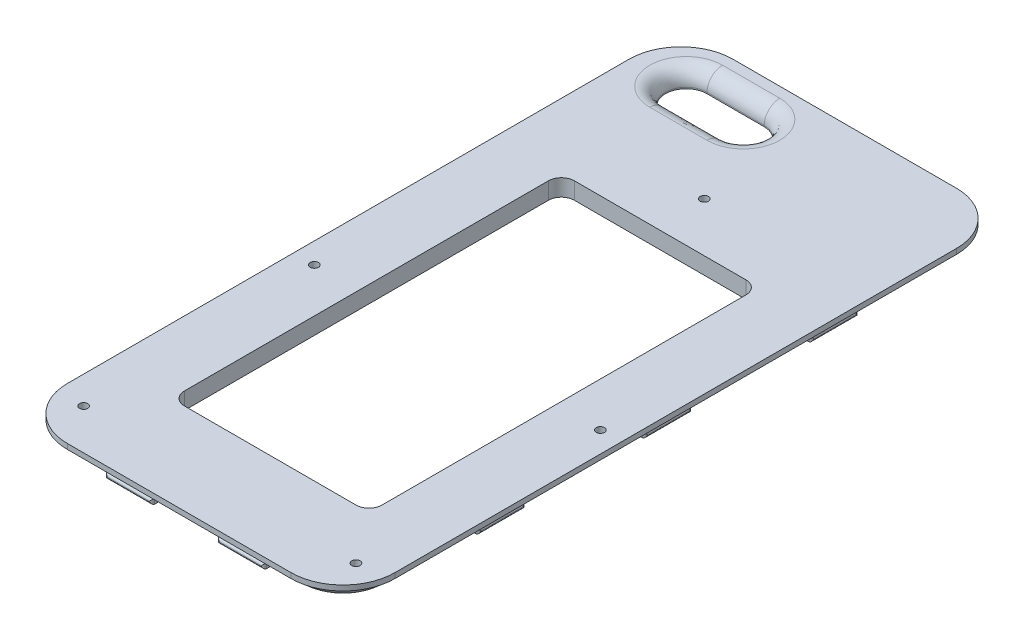
from build123d import *

# Parameters (mm, degrees)
BOSS_EXTRUDE1_DEPTH = 1
BOSS_EXTRUDE2_DEPTH = 2.25
SKETCH4_W           = 9
SKETCH4_H           = 1
BOSS_EXTRUDE3_DEPTH = 1
FILLET1_R           = 0.5
SKETCH5_W           = 9
SKETCH5_H           = 1
BOSS_EXTRUDE4_DEPTH = 1
FILLET2_R           = 0.5
SKETCH6_W           = 9
SKETCH6_H           = 1
BOSS_EXTRUDE5_DEPTH = 0.6
FILLET3_R           = 0.5
SKETCH7_W           = 9
SKETCH7_H           = 1
BOSS_EXTRUDE6_DEPTH = 0.6
FILLET4_R           = 0.5
CUT_EXTRUDE1_DEPTH  = 4
CUT_EXTRUDE2_DEPTH  = 4
FILLET6_R           = 1
FILLET7_SIZE        = 3
SKETCH12_R          = 0.8
CUT_EXTRUDE5_DEPTH  = 12
CHAMFER3_SIZE       = 1.5
CHAMFER3_SIZE_2     = 0.866025404
CHAMFER4_SIZE       = 1.5
CHAMFER4_SIZE_2     = 0.866025404


# Some blends are built 0.0001 mm under size
with BuildPart() as part:
    # Sketch2 → Boss-Extrude1 (new body)
    with BuildSketch(Plane(origin=(0, 0, 0), x_dir=(1, 0, 0), z_dir=(0, 1, 0))):
        with BuildLine():
            Line((-51.171175855, 92.369672547), (-51.171175855, -15.630327453))
            ThreePointArc((-51.171175855, -15.630327453), (-48.242243667, -22.701395265), (-41.171175855, -25.630327453))
            Line((-41.171175855, -25.630327453), (1.828824145, -25.630327453))
            ThreePointArc((1.828824145, -25.630327453), (8.899891957, -22.701395265), (11.828824145, -15.630327453))
            Line((11.828824145, -15.630327453), (11.828824145, 92.369672547))
            ThreePointArc((11.828824145, 92.369672547), (8.899891957, 99.440740359), (1.828824145, 102.369672547))
            Line((1.828824145, 102.369672547), (-41.171175855, 102.369672547))
            ThreePointArc((-41.171175855, 102.369672547), (-48.242243667, 99.440740359), (-51.171175855, 92.369672547))
        make_face()
    extrude(amount=BOSS_EXTRUDE1_DEPTH)

    # Sketch3 → Boss-Extrude2 (add)
    with BuildSketch(Plane.XZ):
        with BuildLine():
            Line((-41.171175855, -100.369672547), (1.828824145, -100.369672547))
            ThreePointArc((1.828824145, -100.369672547), (7.485678395, -98.026526797), (9.828824145, -92.369672547))
            Line((9.828824145, -92.369672547), (9.828824145, 15.630327453))
            ThreePointArc((9.828824145, 15.630327453), (7.485678395, 21.287181702), (1.828824145, 23.630327453))
            Line((1.828824145, 23.630327453), (-41.171175855, 23.630327453))
            ThreePointArc((-41.171175855, 23.630327453), (-46.828030104, 21.287181702), (-49.171175855, 15.630327453))
            Line((-49.171175855, 15.630327453), (-49.171175855, -92.369672547))
            ThreePointArc((-49.171175855, -92.369672547), (-46.828030104, -98.026526797), (-41.171175855, -100.369672547))
        make_face()
    extrude(amount=BOSS_EXTRUDE2_DEPTH)

    # Sketch4 → Boss-Extrude3 (add)
    with BuildSketch(Plane(origin=(0, 0, -100.369672547), x_dir=(-1, 0, 0), z_dir=(0, 0, -1))):
        with Locations((30.421175855, -1.75)):
            Rectangle(SKETCH4_W, SKETCH4_H)
        with Locations((8.921175855, -1.75)):
            Rectangle(SKETCH4_W, SKETCH4_H)
    extrude(amount=BOSS_EXTRUDE3_DEPTH)

    # Fillet1
    fillet1_edges = [part.edges().sort_by_distance(p)[0] for p in [
        (-25.921175855, -1.75, -101.369672547),
        (-30.421175855, -2.25, -101.369672547),
        (-34.921175855, -1.75, -101.369672547),
        (-30.421175855, -1.25, -101.369672547),
        (-4.421175855, -1.75, -101.369672547),
        (-8.921175855, -2.25, -101.369672547),
        (-13.421175855, -1.75, -101.369672547),
        (-8.921175855, -1.25, -101.369672547),
    ]]
    fillet(fillet1_edges, radius=FILLET1_R - 0.0001)  # a hair under: the kernel refuses the full size

    # Sketch5 → Boss-Extrude4 (add)
    with BuildSketch(Plane.XY.offset(23.630327453)):
        with Locations((-8.921175855, -1.75)):
            Rectangle(SKETCH5_W, SKETCH5_H)
        with Locations((-30.421175855, -1.75)):
            Rectangle(SKETCH5_W, SKETCH5_H)
    extrude(amount=BOSS_EXTRUDE4_DEPTH)

    # Fillet2
    fillet2_edges = [part.edges().sort_by_distance(p)[0] for p in [
        (-34.921175855, -1.75, 24.630327453),
        (-30.421175855, -2.25, 24.630327453),
        (-25.921175855, -1.75, 24.630327453),
        (-30.421175855, -1.25, 24.630327453),
        (-13.421175855, -1.75, 24.630327453),
        (-8.921175855, -2.25, 24.630327453),
        (-4.421175855, -1.75, 24.630327453),
        (-8.921175855, -1.25, 24.630327453),
    ]]
    fillet(fillet2_edges, radius=FILLET2_R - 0.0001)  # a hair under: the kernel refuses the full size

    # Sketch6 → Boss-Extrude5 (add)
    with BuildSketch(Plane.ZY.offset(49.171175855)):
        with Locations((-6.369672547, -1.75)):
            Rectangle(SKETCH6_W, SKETCH6_H)
        with Locations((-38.369672547, -1.75)):
            Rectangle(SKETCH6_W, SKETCH6_H)
        with Locations((-70.869672547, -1.75)):
            Rectangle(SKETCH6_W, SKETCH6_H)
    extrude(amount=BOSS_EXTRUDE5_DEPTH)

    # Fillet3
    fillet3_edges = [part.edges().sort_by_distance(p)[0] for p in [
        (-49.771175855, -2.25, -6.369672547),
        (-49.771175855, -1.75, -1.869672547),
        (-49.771175855, -1.25, -6.369672547),
        (-49.771175855, -1.75, -10.869672547),
        (-49.771175855, -2.25, -70.869672547),
        (-49.771175855, -1.75, -66.369672547),
        (-49.771175855, -1.25, -70.869672547),
        (-49.771175855, -1.75, -75.369672547),
        (-49.771175855, -1.75, -42.869672547),
        (-49.771175855, -2.25, -38.369672547),
        (-49.771175855, -1.75, -33.869672547),
        (-49.771175855, -1.25, -38.369672547),
    ]]
    fillet(fillet3_edges, radius=FILLET3_R - 0.0001)  # a hair under: the kernel refuses the full size

    # Sketch7 → Boss-Extrude6 (add)
    with BuildSketch(Plane(origin=(9.828824145, 0, 0), x_dir=(0, 0, -1), z_dir=(1, 0, 0))):
        with Locations((70.369672547, -1.75)):
            Rectangle(SKETCH7_W, SKETCH7_H)
        with Locations((38.369672547, -1.75)):
            Rectangle(SKETCH7_W, SKETCH7_H)
        with Locations((6.369672547, -1.75)):
            Rectangle(SKETCH7_W, SKETCH7_H)
    extrude(amount=BOSS_EXTRUDE6_DEPTH)

    # Fillet4
    fillet4_edges = [part.edges().sort_by_distance(p)[0] for p in [
        (10.428824145, -2.25, -70.369672547),
        (10.428824145, -1.75, -74.869672547),
        (10.428824145, -1.25, -70.369672547),
        (10.428824145, -1.75, -65.869672547),
        (10.428824145, -1.75, -33.869672547),
        (10.428824145, -2.25, -38.369672547),
        (10.428824145, -1.75, -42.869672547),
        (10.428824145, -1.25, -38.369672547),
        (10.428824145, -2.25, -6.369672547),
        (10.428824145, -1.75, -10.869672547),
        (10.428824145, -1.25, -6.369672547),
        (10.428824145, -1.75, -1.869672547),
    ]]
    fillet(fillet4_edges, radius=FILLET4_R - 0.0001)  # a hair under: the kernel refuses the full size

    # Sketch8 → Cut-Extrude1 (cut)
    with BuildSketch(Plane.XZ.offset(2.25)):
        with BuildLine():
            Line((-30.171175855, -89.369672547), (-41.171175855, -89.369672547))
            ThreePointArc((-41.171175855, -89.369672547), (-45.171175855, -93.369672547), (-41.171175855, -97.369672547))
            Line((-41.171175855, -97.369672547), (-30.171175855, -97.369672547))
            ThreePointArc((-30.171175855, -97.369672547), (-26.171175855, -93.369672547), (-30.171175855, -89.369672547))
        make_face()
    extrude(amount=-CUT_EXTRUDE1_DEPTH, mode=Mode.SUBTRACT)

    # Sketch9 → Cut-Extrude2 (cut)
    with BuildSketch(Plane.XZ.offset(2.25)):
        with BuildLine():
            Line((-0.671175855, -64.369672547), (-0.671175855, 5.630327453))
            ThreePointArc((-0.671175855, 5.630327453), (-1.403408902, 7.398094406), (-3.171175855, 8.130327453))
            Line((-3.171175855, 8.130327453), (-36.171175855, 8.130327453))
            ThreePointArc((-36.171175855, 8.130327453), (-37.938942808, 7.398094406), (-38.671175855, 5.630327453))
            Line((-38.671175855, 5.630327453), (-38.671175855, -64.369672547))
            ThreePointArc((-38.671175855, -64.369672547), (-37.938942808, -66.1374395), (-36.171175855, -66.869672547))
            Line((-36.171175855, -66.869672547), (-3.171175855, -66.869672547))
            ThreePointArc((-3.171175855, -66.869672547), (-1.403408902, -66.1374395), (-0.671175855, -64.369672547))
        make_face()
    extrude(amount=-CUT_EXTRUDE2_DEPTH, mode=Mode.SUBTRACT)

    # Fillet6
    fillet6_edges = [part.edges().sort_by_distance(p)[0] for p in [
        (9.828824145, -2.25, 6.880327453),
        (7.485678395, -2.25, 21.287181702),
        (-38.046175855, -2.25, 23.630327453),
        (-46.828030104, -2.25, 21.287181702),
        (-49.171175855, -2.25, -83.869672547),
        (-46.828030104, -2.25, -98.026526797),
        (-1.296175855, -2.25, -100.369672547),
        (9.828824145, -2.25, -83.619672547),
        (9.828824145, -2.25, -22.369672547),
        (9.828824145, -2.25, -54.369672547),
        (-1.296175855, -2.25, 23.630327453),
        (-19.671175855, -2.25, 23.630327453),
        (-49.171175855, -2.25, 6.880327453),
        (-49.171175855, -2.25, -22.369672547),
        (-49.171175855, -2.25, -54.619672547),
        (-38.046175855, -2.25, -100.369672547),
        (-19.671175855, -2.25, -100.369672547),
        (7.485678395, -2.25, -98.026526797),
    ]]
    fillet(fillet6_edges, radius=FILLET6_R)

    # Fillet7
    # a fillet whose section is not a circle: 3 mm, written as the material it takes off along each edge
    with BuildSketch(Plane(origin=(-30.171175855, 1, -93.369672547), x_dir=(0, 0, -1), z_dir=(-1, 0, 0))) as fillet7_piece_1:
        with BuildLine():
            Bezier((4 + FILLET7_SIZE, 0), (4, 0), (4, FILLET7_SIZE), weights=[1, 0.707106781, 1])
            Line((4, FILLET7_SIZE), (4, 0))
            Line((4, 0), (4 + FILLET7_SIZE, 0))
        make_face()
    revolve(axis=Axis((-30.171175855, 1, -93.369672547), (0, -1, 0)), revolution_arc=180, mode=Mode.SUBTRACT)
    with BuildSketch(Plane(origin=(-30.171175855, 1, -97.369672547), x_dir=(0, 0, -1), z_dir=(-1, 0, 0)), Plane(origin=(-41.171175855, 1, -89.369672547), x_dir=(0, 0, 1), z_dir=(1, 0, 0))) as fillet7_piece_2:
        with BuildLine():
            Bezier((FILLET7_SIZE, 0), (0, 0), (0, FILLET7_SIZE), weights=[1, 0.707106781, 1])
            Line((0, FILLET7_SIZE), (0, 0))
            Line((0, 0), (FILLET7_SIZE, 0))
        make_face()
    extrude(amount=11, mode=Mode.SUBTRACT)
    with BuildSketch(Plane(origin=(-41.171175855, 1, -93.369672547), x_dir=(0, 0, 1), z_dir=(1, 0, 0))) as fillet7_piece_3:
        with BuildLine():
            Bezier((4 + FILLET7_SIZE, 0), (4, 0), (4, FILLET7_SIZE), weights=[1, 0.707106781, 1])
            Line((4, FILLET7_SIZE), (4, 0))
            Line((4, 0), (4 + FILLET7_SIZE, 0))
        make_face()
    revolve(axis=Axis((-41.171175855, 1, -93.369672547), (0, -1, 0)), revolution_arc=180, mode=Mode.SUBTRACT)

    # Sketch12 → Cut-Extrude5 (cut)
    with BuildSketch(Plane(origin=(0, 1, 0), x_dir=(1, 0, 0), z_dir=(0, 1, 0))):
        with Locations(Location((-20.671175855, 76.359672547, 0), (0, 0, 270))):
            Circle(SKETCH12_R)
        with Locations(Location((7.828824145, 27.859672547, 0), (0, 0, 270))):
            Circle(SKETCH12_R)
        with Locations(Location((6.508824145, -17.820327453, 0), (0, 0, 270))):
            Circle(SKETCH12_R)
        with Locations(Location((-45.851175855, -17.820327453, 0), (0, 0, 270))):
            Circle(SKETCH12_R)
        with Locations(Location((-47.171175855, 27.859672547, 0), (0, 0, 270))):
            Circle(SKETCH12_R)
    extrude(amount=-CUT_EXTRUDE5_DEPTH, mode=Mode.SUBTRACT)

    # Chamfer3
    # the kernel refuses this chamfer: 1.5, 0.866025404 mm, written as the material it takes off along each edge
    with BuildSketch(Plane(origin=(-20.671175855, -2.25, -76.359672547), x_dir=(0, 0, 1), z_dir=(-1, 0, 0))) as chamfer3_piece_1:
        Polygon((0.8 + CHAMFER3_SIZE, 0), (0.8, CHAMFER3_SIZE_2), (0.8, 0), align=None)
    revolve(axis=Axis((-20.671175855, -2.25, -76.359672547), (0, 1, 0)), mode=Mode.SUBTRACT)
    with BuildSketch(Plane(origin=(6.508824145, -2.25, 17.820327453), x_dir=(0, 0, 1), z_dir=(-1, 0, 0))) as chamfer3_piece_2:
        Polygon((0.8 + CHAMFER3_SIZE, 0), (0.8, CHAMFER3_SIZE_2), (0.8, 0), align=None)
    revolve(axis=Axis((6.508824145, -2.25, 17.820327453), (0, 1, 0)), mode=Mode.SUBTRACT)
    with BuildSketch(Plane(origin=(-45.851175855, -2.25, 17.820327453), x_dir=(0, 0, 1), z_dir=(-1, 0, 0))) as chamfer3_piece_3:
        Polygon((0.8 + CHAMFER3_SIZE, 0), (0.8, CHAMFER3_SIZE_2), (0.8, 0), align=None)
    revolve(axis=Axis((-45.851175855, -2.25, 17.820327453), (0, 1, 0)), mode=Mode.SUBTRACT)

    # Chamfer4
    # the kernel refuses this chamfer: 1.5, 0.866025404 mm, written as the material it takes off along each edge
    with BuildSketch(Plane(origin=(7.828824145, -2.25, -27.859672547), x_dir=(0, 0, 1), z_dir=(-1, 0, 0))) as chamfer4_piece_1:
        Polygon((0.8 + CHAMFER4_SIZE, 0), (0.8, CHAMFER4_SIZE_2), (0.8, 0), align=None)
    revolve(axis=Axis((7.828824145, -2.25, -27.859672547), (0, 1, 0)), mode=Mode.SUBTRACT)
    with BuildSketch(Plane(origin=(-47.171175855, -2.25, -27.859672547), x_dir=(0, 0, 1), z_dir=(-1, 0, 0))) as chamfer4_piece_2:
        Polygon((0.8 + CHAMFER4_SIZE, 0), (0.8, CHAMFER4_SIZE_2), (0.8, 0), align=None)
    revolve(axis=Axis((-47.171175855, -2.25, -27.859672547), (0, 1, 0)), mode=Mode.SUBTRACT)


solid = part.part
